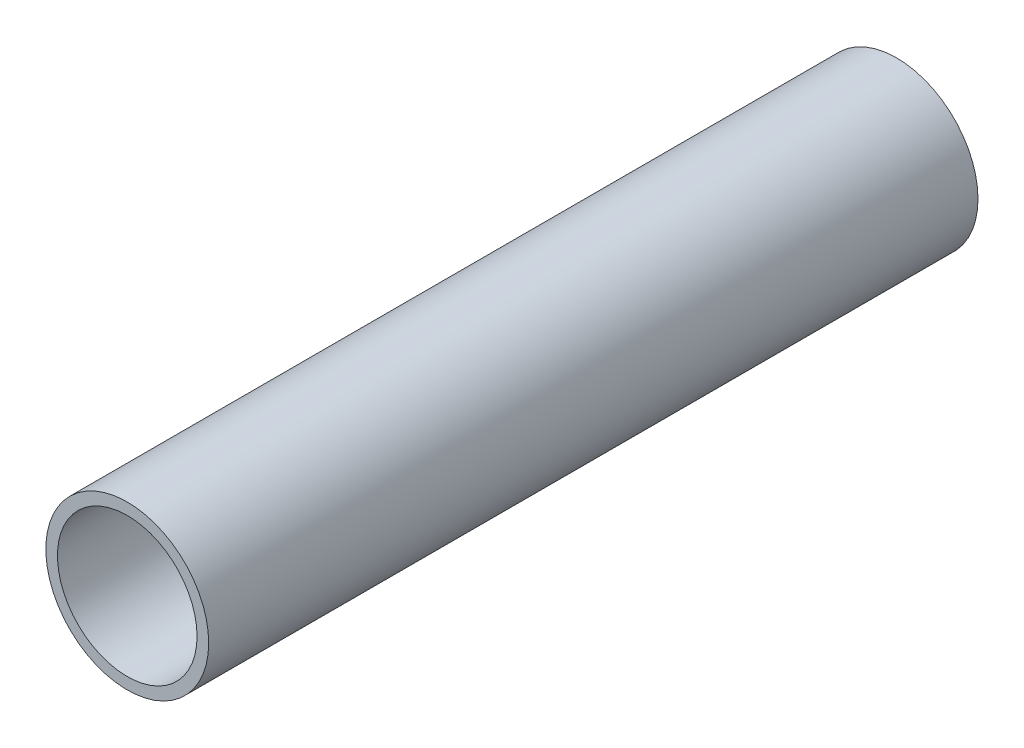
from build123d import *

# Parameters (mm, degrees)
SKETCH1_R           = 44.45
SKETCH1_R_2         = 38.1
BOSS_EXTRUDE1_DEPTH = 420


with BuildPart() as part:
    # Sketch1 → Boss-Extrude1 (new body)
    with BuildSketch(Plane.XY):
        Circle(SKETCH1_R)
        Circle(SKETCH1_R_2, mode=Mode.SUBTRACT)
    extrude(amount=BOSS_EXTRUDE1_DEPTH)


solid = part.part
